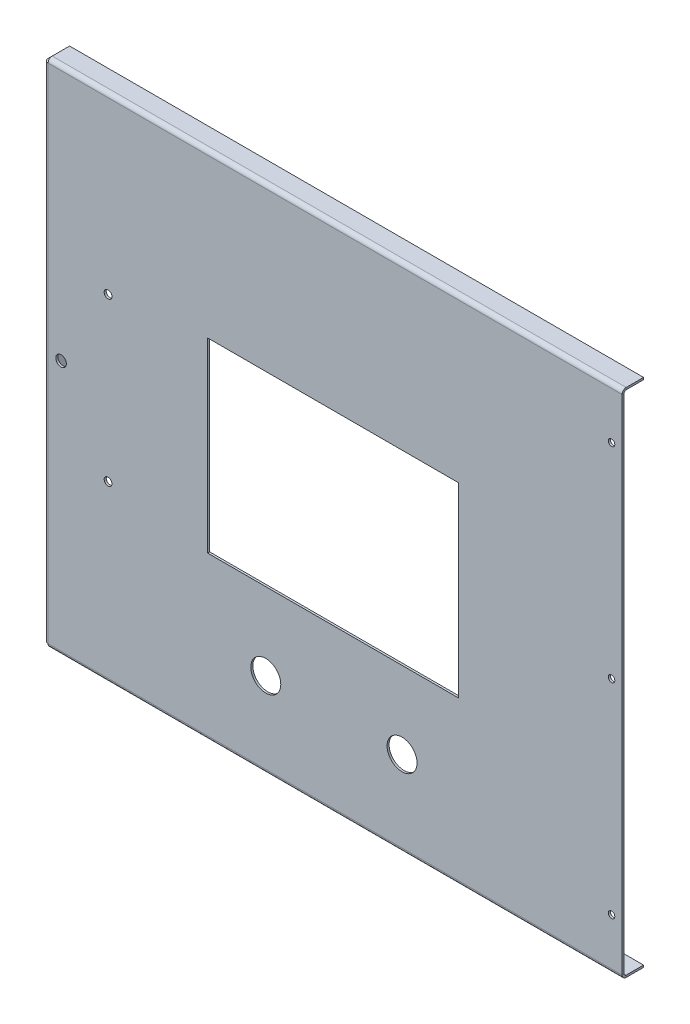
from build123d import *

# Parameters (mm, degrees)
CROQUIS1_W                         = 431.038
CROQUIS1_H                         = 381
BRIDA_BASE1_DEPTH                  = 1.524
CROQUIS6_W                         = 3.048
CROQUIS6_H                         = 3.048
CORTAR_EXTRUIR1_DEPTH              = 288.647374292
BRIDA_DE_ARISTA1_STRIP_W           = 9.144
BRIDA_DE_ARISTA1_STRIP_H           = 1.524
BRIDA_DE_ARISTA1_STRIP_CUT_DEPTH   = 427.99
BRIDA_DE_ARISTA1_STRIP_2_W         = 9.144
BRIDA_DE_ARISTA1_STRIP_2_H         = 1.524
BRIDA_DE_ARISTA1_STRIP_CUT_2_DEPTH = 374.904
BRIDA_DE_ARISTA1_STRIP_3_W         = 9.144
BRIDA_DE_ARISTA1_STRIP_3_H         = 1.524
BRIDA_DE_ARISTA1_STRIP_CUT_3_DEPTH = 427.99
BRIDA_DE_ARISTA1_DEPTH             = 427.99
BRIDA_DE_ARISTA1_BEND_DEPTH        = 374.904
BRIDA_DE_ARISTA1_BEND_2_DEPTH      = 427.99
CROQUIS16_R                        = 3.9624
CROQUIS16_R_2                      = 2.8956
CROQUIS16_R_3                      = 11.176
CROQUIS16_R_4                      = 2.413
CROQUIS16_W                        = 186.944
CROQUIS16_H                        = 138.938
CORTAR_EXTRUIR2_DEPTH              = 289.088100006


# Sheet-metal steps are written as plain solids
with BuildPart() as part:
    # Croquis1 → Brida base1 (new body)
    with BuildSketch(Plane.XY):
        Rectangle(CROQUIS1_W, CROQUIS1_H)
    extrude(amount=-BRIDA_BASE1_DEPTH)

    # Croquis6 → Cortar-Extruir1 (cut, through all)
    with BuildSketch(Plane.XY):
        with Locations((-213.995, 188.976)):
            Rectangle(CROQUIS6_W, CROQUIS6_H)
        with Locations((-213.995, -188.976)):
            Rectangle(CROQUIS6_W, CROQUIS6_H)
    extrude(amount=-CORTAR_EXTRUIR1_DEPTH, mode=Mode.SUBTRACT)

    # Brida de arista1 strip (across the edge) → Brida de arista1 strip cut (cut)
    with BuildSketch(Plane(origin=(-212.471, 190.5, -1.524), x_dir=(0, -1, 0), z_dir=(1, 0, 0))):
        with Locations((-1.524, -0.762)):
            Rectangle(BRIDA_DE_ARISTA1_STRIP_W, BRIDA_DE_ARISTA1_STRIP_H)
    extrude(amount=BRIDA_DE_ARISTA1_STRIP_CUT_DEPTH, mode=Mode.SUBTRACT)

    # Brida de arista1 strip 2 (across the edge) → Brida de arista1 strip cut 2 (cut)
    with BuildSketch(Plane(origin=(-215.519, -187.452, -1.524), x_dir=(1, 0, 0), z_dir=(0, 1, 0))):
        with Locations((-1.524, -0.762)):
            Rectangle(BRIDA_DE_ARISTA1_STRIP_2_W, BRIDA_DE_ARISTA1_STRIP_2_H)
    extrude(amount=BRIDA_DE_ARISTA1_STRIP_CUT_2_DEPTH, mode=Mode.SUBTRACT)

    # Brida de arista1 strip 3 (across the edge) → Brida de arista1 strip cut 3 (cut)
    with BuildSketch(Plane(origin=(215.519, -190.5, -1.524), x_dir=(0, 1, 0), z_dir=(-1, 0, 0))):
        with Locations((-1.524, -0.762)):
            Rectangle(BRIDA_DE_ARISTA1_STRIP_3_W, BRIDA_DE_ARISTA1_STRIP_3_H)
    extrude(amount=BRIDA_DE_ARISTA1_STRIP_CUT_3_DEPTH, mode=Mode.SUBTRACT)

    # Brida de arista1 section (across the edge) → Brida de arista1 (add)
    with BuildSketch(Plane(origin=(-212.471, 190.5, -1.524), x_dir=(0, -1, 0), z_dir=(1, 0, 0))):
        with BuildLine():
            Line((0, 1.524), (0, 14.478))
            Line((0, 14.478), (1.524, 14.478))
            Line((1.524, 14.478), (1.524, 1.524))
            ThreePointArc((1.524, 1.524), (1.970369265, 0.446369265), (3.048, 0))
            Line((3.048, 0), (3.048, -1.524))
            ThreePointArc((3.048, -1.524), (0.892738531, -0.631261469), (0, 1.524))
        make_face()
    extrude(amount=BRIDA_DE_ARISTA1_DEPTH)

    # Brida de arista1 section 2 (across the edge) → Brida de arista1 bend (add)
    with BuildSketch(Plane(origin=(-215.519, -187.452, -1.524), x_dir=(1, 0, 0), z_dir=(0, 1, 0))):
        with BuildLine():
            Line((0, 1.524), (0, 14.478))
            Line((0, 14.478), (1.524, 14.478))
            Line((1.524, 14.478), (1.524, 1.524))
            ThreePointArc((1.524, 1.524), (1.970369265, 0.446369265), (3.048, 0))
            Line((3.048, 0), (3.048, -1.524))
            ThreePointArc((3.048, -1.524), (0.892738531, -0.631261469), (0, 1.524))
        make_face()
    extrude(amount=BRIDA_DE_ARISTA1_BEND_DEPTH)

    # Brida de arista1 section 3 (across the edge) → Brida de arista1 bend 2 (add)
    with BuildSketch(Plane(origin=(215.519, -190.5, -1.524), x_dir=(0, 1, 0), z_dir=(-1, 0, 0))):
        with BuildLine():
            Line((0, 1.524), (0, 14.478))
            Line((0, 14.478), (1.524, 14.478))
            Line((1.524, 14.478), (1.524, 1.524))
            ThreePointArc((1.524, 1.524), (1.970369265, 0.446369265), (3.048, 0))
            Line((3.048, 0), (3.048, -1.524))
            ThreePointArc((3.048, -1.524), (0.892738531, -0.631261469), (0, 1.524))
        make_face()
    extrude(amount=BRIDA_DE_ARISTA1_BEND_2_DEPTH)

    # Croquis16 → Cortar-Extruir2 (cut, through all)
    with BuildSketch(Plane.XY):
        with Locations((-202.819, 0)):
            Circle(CROQUIS16_R)
        with Locations((-167.767, 60.452)):
            Circle(CROQUIS16_R_2)
        with Locations((-167.767, -60.452)):
            Circle(CROQUIS16_R_2)
        with Locations((-50.165, -127)):
            Circle(CROQUIS16_R_3)
        with Locations((51.435, -127)):
            Circle(CROQUIS16_R_3)
        with Locations((207.645, 152.4)):
            Circle(CROQUIS16_R_4)
        with Locations((207.645, 0)):
            Circle(CROQUIS16_R_4)
        with Locations((207.645, -152.4)):
            Circle(CROQUIS16_R_4)
        with Locations((-0.127, 0)):
            Rectangle(CROQUIS16_W, CROQUIS16_H)
    extrude(amount=-CORTAR_EXTRUIR2_DEPTH, mode=Mode.SUBTRACT)


solid = part.part
